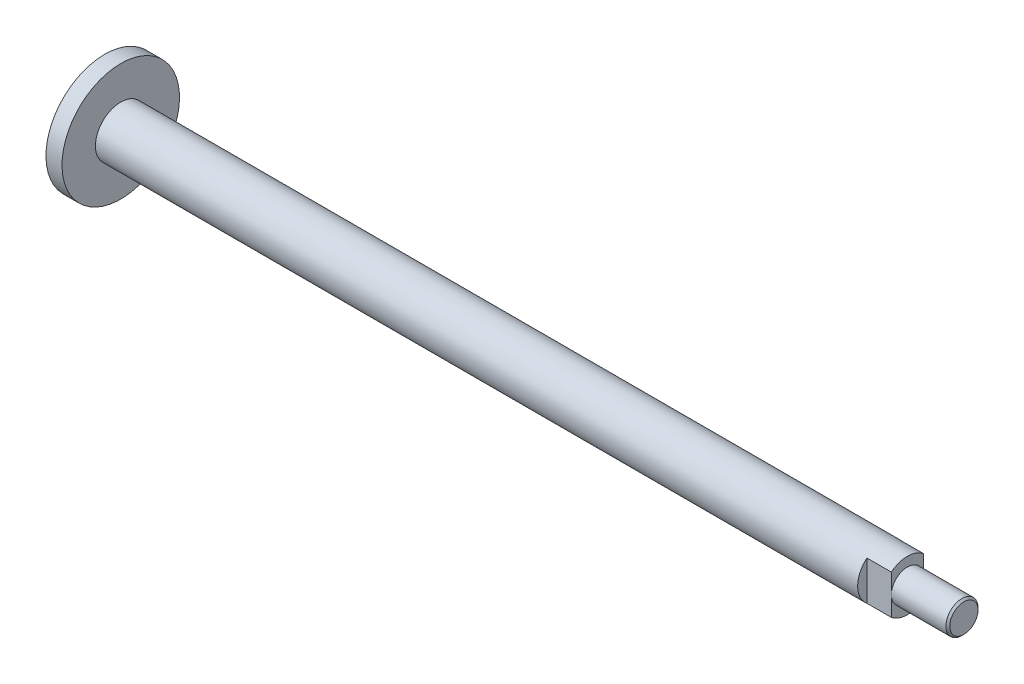
from build123d import *

# Parameters (mm, degrees)
CUT_EXTRUDE1_DEPTH = 32.004


# Read off the part's stored shape, not the designer's step: 1/2-20 Machine Threads Stud1
with BuildPart() as part:
    # Sketch2 → Revolve1 (revolve)
    with BuildSketch(Plane.XY):
        Polygon((0, 0), (0, 23.241), (6.35, 23.241), (6.35, 10.033), (339.979, 10.033), (339.979, 0), align=None)
    revolve(axis=Axis((339.979, 0, 0), (-1, 0, 0)))

    # 1/2-20 Machine Threads Stud1 outline → 1/2-20 Machine Threads Stud1 (revolve, cut)
    with BuildSketch(Plane.YX):
        Polygon((10.033, 339.979), (5.59435, 339.979), (6.35, 339.22335), (6.35, 317.627), (10.033, 317.627), align=None)
    revolve(axis=Axis((0, 0, 0), (1, 0, 0)), mode=Mode.SUBTRACT)

    # Sketch7 → Cut-Extrude1 (cut)
    with BuildSketch(Plane(origin=(339.979, 0, 0), x_dir=(0, 0, -1), z_dir=(1, 0, 0))):
        with BuildLine():
            Line((-6.35, 7.767791771), (-6.35, -7.767791771))
            ThreePointArc((-6.35, -7.767791771), (-10.033, 0), (-6.35, 7.767791771))
        make_face()
        with BuildLine():
            Line((6.35, 7.767791771), (6.35, -7.767791771))
            ThreePointArc((6.35, -7.767791771), (10.033, 0), (6.35, 7.767791771))
        make_face()
    extrude(amount=-CUT_EXTRUDE1_DEPTH, mode=Mode.SUBTRACT)


solid = part.part
